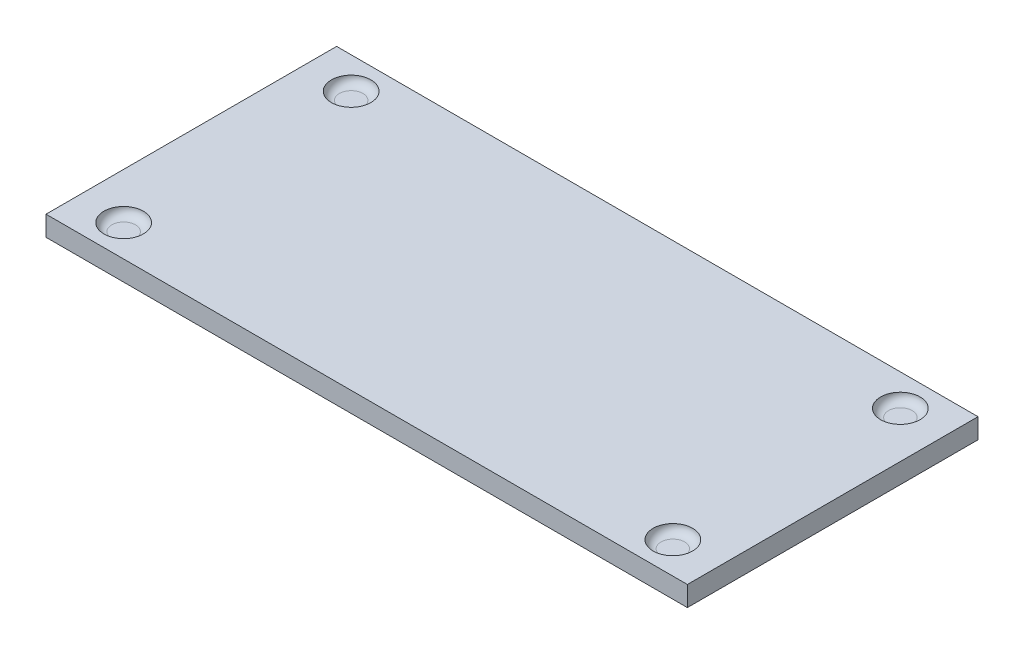
from build123d import *

# Parameters (mm, degrees)
SKETCH1_W           = 406.4
SKETCH1_H           = 184.15
BOSS_EXTRUDE1_DEPTH = 12.7
SKETCH2_R           = 12.5
CUT_EXTRUDE1_DEPTH  = 5
FILLET1_R           = 5


with BuildPart() as part:
    # Sketch1 → Boss-Extrude1 (new body)
    with BuildSketch(Plane(origin=(0, 0, 0), x_dir=(1, 0, 0), z_dir=(0, 1, 0))):
        with Locations((203.2, 92.075)):
            Rectangle(SKETCH1_W, SKETCH1_H)
    extrude(amount=BOSS_EXTRUDE1_DEPTH)

    # Sketch2 → Cut-Extrude1 (cut)
    with BuildSketch(Plane(origin=(0, 12.7, 0), x_dir=(1, 0, 0), z_dir=(0, 1, 0))):
        with Locations(Location((29.195557492, 20, 0), (0, 0, 270))):
            Circle(SKETCH2_R)
        with Locations(Location((377.204442508, 20, 0), (0, 0, 270))):
            Circle(SKETCH2_R)
        with Locations(Location((377.204442508, 164.15, 0), (0, 0, 270))):
            Circle(SKETCH2_R)
        with Locations(Location((29.195557492, 164.15, 0), (0, 0, 270))):
            Circle(SKETCH2_R)
    extrude(amount=-CUT_EXTRUDE1_DEPTH, mode=Mode.SUBTRACT)

    # Fillet1
    fillet1_edges = [part.edges().sort_by_distance(p)[0] for p in [
        (29.195557492, 7.7, -176.65),
        (377.204442508, 7.7, -176.65),
        (377.204442508, 7.7, -32.5),
        (29.195557492, 7.7, -32.5),
    ]]
    fillet(fillet1_edges, radius=FILLET1_R - 0.0001)  # a hair under: the kernel refuses the full size


solid = part.part
